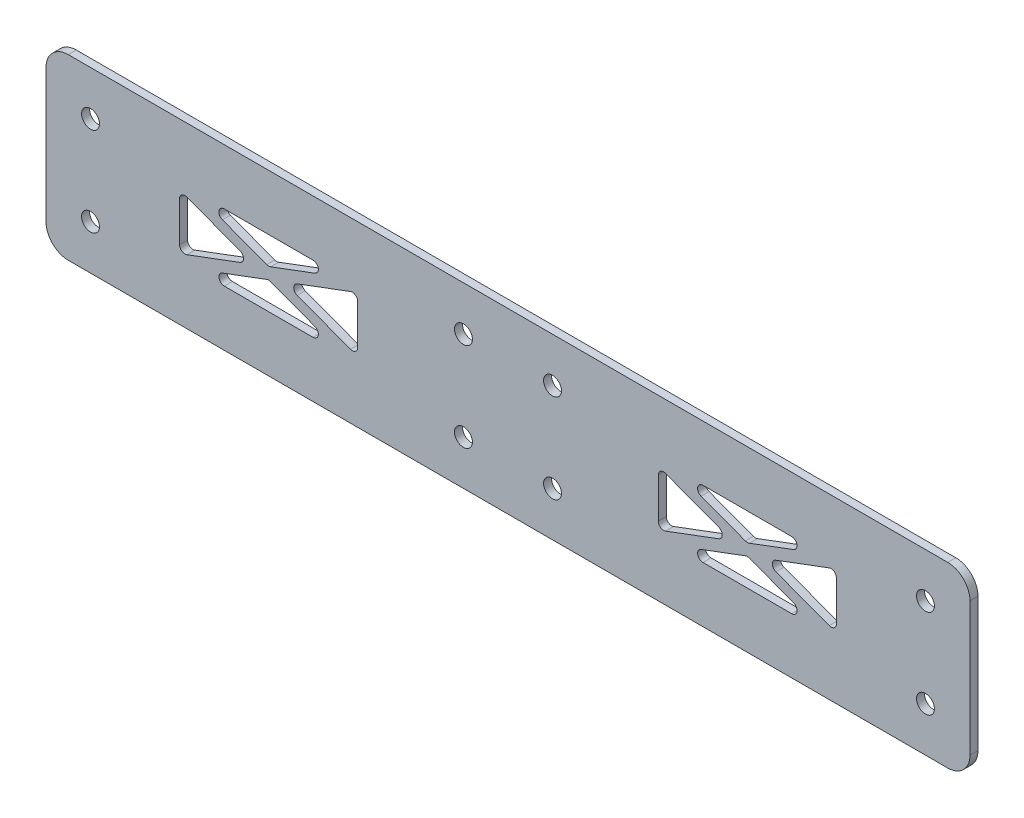
from build123d import *

# Parameters (mm, degrees)
SKETCH1_W              = 263.525
SKETCH1_H              = 50.8
BOSS_EXTRUDE1_DEPTH    = 1.143
F_10_CLEARANCE_HOLE1_D = 5.1054
FILLET1_R              = 6.35
CUT_EXTRUDE1_DEPTH     = 135.20783212
FILLET2_R              = 1.524


with BuildPart() as part:
    # Sketch1 → Boss-Extrude1 (new, symmetric)
    with BuildSketch(Plane.XY):
        Rectangle(SKETCH1_W, SKETCH1_H)
    extrude(amount=BOSS_EXTRUDE1_DEPTH, both=True)

    # #10 Clearance Hole1 (through all)
    with Locations(Plane.XY.offset(1.143)):
        with Locations((-119.0625, 12.7), (-119.0625, -12.7), (-12.7, 12.7), (-12.7, -12.7), (12.7, -12.7), (12.7, 12.7), (119.0625, 12.7), (119.0625, -12.7)):
            Hole(F_10_CLEARANCE_HOLE1_D / 2)

    # Fillet1
    fillet1_edges = [part.edges().sort_by_distance(p)[0] for p in [
        (131.7625, -25.4, 0),
        (-131.7625, -25.4, 0),
        (131.7625, 25.4, 0),
        (-131.7625, 25.4, 0),
    ]]
    fillet(fillet1_edges, radius=FILLET1_R)

    # Sketch4 → Cut-Extrude1 (cut, through all)
    with BuildSketch(Plane.XY.offset(1.143)):
        Polygon((-47.202853903, 9.525), (-89.322146097, 9.525), (-68.2625, 1.627632713), align=None)
        Polygon((-72.602853903, 0), (-93.6625, 7.897367287), (-93.6625, -7.897367287), align=None)
        Polygon((-42.8625, 7.897367287), (-63.922146097, 0), (-42.8625, -7.897367287), align=None)
        Polygon((-47.202853903, -9.525), (-68.2625, -1.627632713), (-89.322146097, -9.525), align=None)
        Polygon((89.322146097, 9.525), (47.202853903, 9.525), (68.2625, 1.627632713), align=None)
        Polygon((63.922146097, 0), (42.8625, 7.897367287), (42.8625, -7.897367287), align=None)
        Polygon((93.6625, 7.897367287), (72.602853903, 0), (93.6625, -7.897367287), align=None)
        Polygon((89.322146097, -9.525), (68.2625, -1.627632713), (47.202853903, -9.525), align=None)
    extrude(amount=-CUT_EXTRUDE1_DEPTH, mode=Mode.SUBTRACT)

    # Fillet2
    fillet2_edges = [part.edges().sort_by_distance(p)[0] for p in [
        (93.6625, 7.897367287, 0),
        (93.6625, -7.897367287, 0),
        (72.602853903, 0, 0),
        (89.322146097, -9.525, 0),
        (47.202853903, -9.525, 0),
        (68.2625, -1.627632713, 0),
        (-42.8625, 7.897367287, 0),
        (-42.8625, -7.897367287, 0),
        (-63.922146097, 0, 0),
        (-47.202853903, 9.525, 0),
        (-68.2625, 1.627632713, 0),
        (-89.322146097, 9.525, 0),
        (-72.602853903, 0, 0),
        (-93.6625, 7.897367287, 0),
        (-68.2625, -1.627632713, 0),
        (-47.202853903, -9.525, 0),
        (-89.322146097, -9.525, 0),
        (63.922146097, 0, 0),
        (42.8625, -7.897367287, 0),
        (42.8625, 7.897367287, 0),
        (89.322146097, 9.525, 0),
        (68.2625, 1.627632713, 0),
        (47.202853903, 9.525, 0),
        (-93.6625, -7.897367287, 0),
    ]]
    fillet(fillet2_edges, radius=FILLET2_R)


solid = part.part
